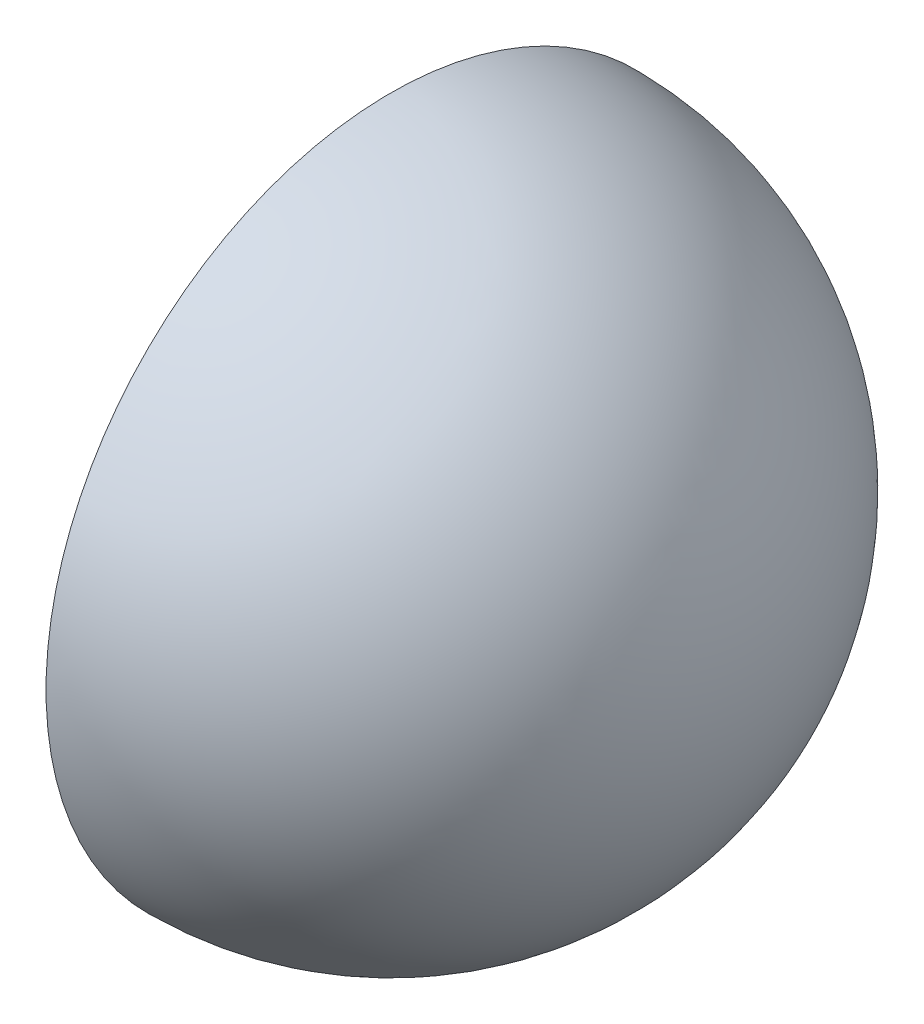
from build123d import *

# Parameters (mm, degrees)
SKETCH2_R           = 25
BOSS_EXTRUDE1_DEPTH = 25
FILLET1_R           = 25
SKETCH3_R           = 13
CUT_EXTRUDE1_DEPTH  = 15
THREAD2_PITCH       = 5
SKETCH17_W          = 32.265191549
SKETCH17_H          = 31.135556834
CUT_EXTRUDE2_DEPTH  = 70


with BuildPart() as part:
    # Sketch2 → Boss-Extrude1 (new body)
    with BuildSketch(Plane(origin=(0, 0, 0), x_dir=(0, 0, -1), z_dir=(1, 0, 0))):
        Circle(SKETCH2_R)
    extrude(amount=BOSS_EXTRUDE1_DEPTH)

    # Fillet1
    fillet1_edges = [part.edges().sort_by_distance(p)[0] for p in [
        (25, 0, 25),
    ]]
    fillet(fillet1_edges, radius=FILLET1_R - 0.0001)  # a hair under: the kernel refuses the full size

    # Sketch3 → Cut-Extrude1 (cut)
    with BuildSketch(Plane.ZY):
        Circle(SKETCH3_R)
    extrude(amount=-CUT_EXTRUDE1_DEPTH, mode=Mode.SUBTRACT)

    # Thread2: the profile of Thread Profile3 profile screwed along a right-hand helix of 3 turns, 12 arcs to a turn; built about Z, then put on its axis
    thread2_z = Axis((0, 0, 0), (0, 0, 1))
    thread2_corners = [(13.0003, -3e-09, -0.000173205), (13.0003, -3e-09, 4.375173191), (10.293670625, -3e-09, 2.812499993), (10.293670625, -3e-09, 1.562499993)]
    with BuildLine(mode=Mode.PRIVATE) as thread2_profile:
        Line(thread2_corners[0], thread2_corners[1])
        Line(thread2_corners[1], thread2_corners[2])
        Line(thread2_corners[2], thread2_corners[3])
        Line(thread2_corners[3], thread2_corners[0])
    thread2_cap = Face(thread2_profile.wire())
    thread2_turn_angles = [0, 15, 30, 45, 60, 75, 90, 105, 120, 135, 150, 165, 180, 195, 210, 225, 240, 255, 270, 285, 300, 315, 330, 345, 360]
    thread2_turn_weights = [1, 0.9659258262890683, 1, 0.9659258262890683, 1, 0.9659258262890683, 1, 0.9659258262890683, 1, 0.9659258262890683, 1, 0.9659258262890683, 1, 0.9659258262890683, 1, 0.9659258262890683, 1, 0.9659258262890683, 1, 0.9659258262890683, 1, 0.9659258262890683, 1, 0.9659258262890683, 1]
    thread2_turn_rails = [Edge.make_bspline([Vector(p[0], p[1], 0).rotate(thread2_z, thread2_turn_angles[k]) / thread2_turn_weights[k] + Vector(0, 0, p[2] + THREAD2_PITCH * thread2_turn_angles[k] / 360) for k in range(25)], [0, 0, 0, 1, 1, 2, 2, 3, 3, 4, 4, 5, 5, 6, 6, 7, 7, 8, 8, 9, 9, 10, 10, 11, 11, 12, 12, 12], 2, thread2_turn_weights) for p in thread2_corners]
    thread2_turn_sides = [Face.make_surface_from_curves(thread2_turn_rails[p[0]], thread2_turn_rails[p[1]]) for p in [(0, 1), (1, 2), (2, 3), (3, 0)]]
    thread2 = Plane(origin=(-4, 0, 0), x_dir=(0, 0.087155743, -0.996194698), z_dir=(1, 0, 0)) * Solid(Shell([*[p.moved(Location((0, 0, THREAD2_PITCH * i))) for i in range(3) for p in thread2_turn_sides], thread2_cap, thread2_cap.rotate(thread2_z, 1080).moved(Location((0, 0, THREAD2_PITCH * 1080 / 360)))]))
    add(thread2)

    # Sketch17 → Cut-Extrude2 (cut)
    with BuildSketch(Plane.ZY):
        with Locations((0.529516272, -0.282408679)):
            Rectangle(SKETCH17_W, SKETCH17_H)
    extrude(amount=CUT_EXTRUDE2_DEPTH, mode=Mode.SUBTRACT)


solid = part.part
